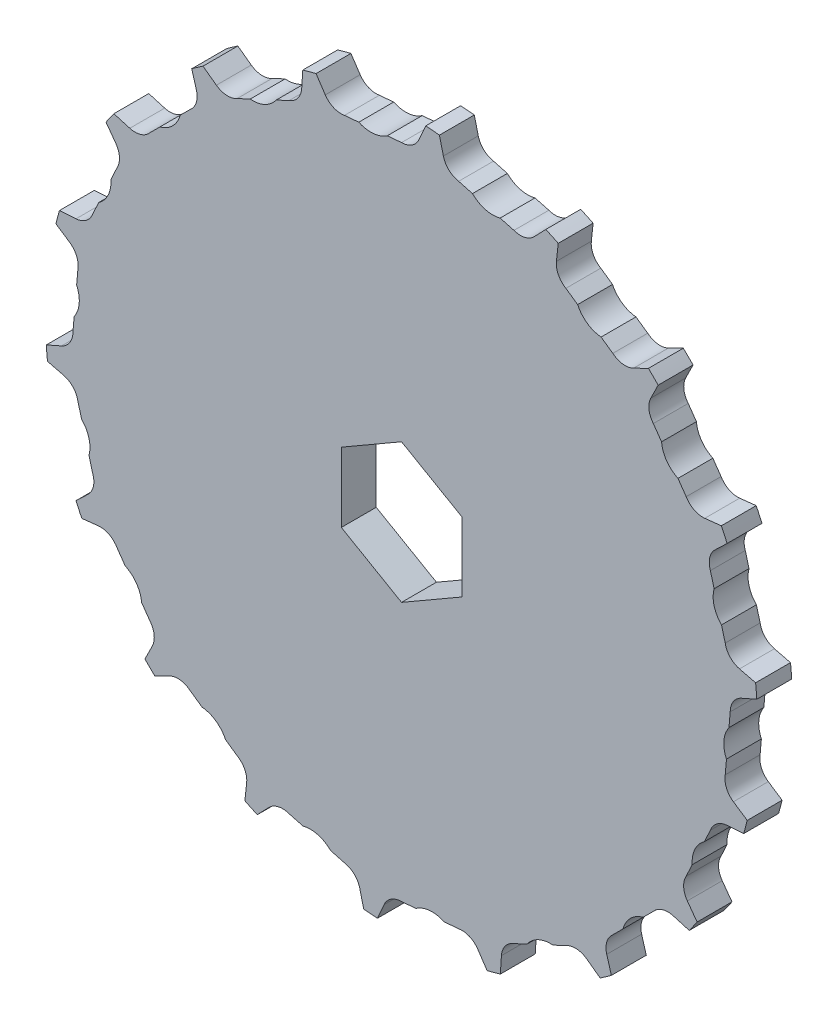
from build123d import *

# Parameters (mm, degrees)
BOSS_EXTRUDE1_DEPTH                 = 7.3
SKETCH2_R                           = 12.5
BOSS_EXTRUDE2_DEPTH                 = 40
CUT_EXTRUDE2_DEPTH                  = 10
SKETCH9_R                           = 100
SKETCH9_R_2                         = 74.5
CUT_EXTRUDE5_DEPTH                  = 10
FILLET1_R                           = 30
SKETCH3_R                           = 5
CUT_EXTRUDE1_DEPTH                  = 116.267299695
F_1_0MM_DOWEL_HOLE1_D               = 2.8
F_1_0MM_DOWEL_HOLE1_DEPTH           = 33.158795133
F_1_0MM_DOWEL_HOLE1_TIP             = 0.841204867
F_1_0MM_DOWEL_HOLE1_ON_FACE_2_D     = 2.8
F_1_0MM_DOWEL_HOLE1_ON_FACE_2_DEPTH = 33.158795133
F_1_0MM_DOWEL_HOLE1_ON_FACE_2_TIP   = 0.841204867
CIRPATTERN1_COUNT                   = 18
CUT_EXTRUDE3_DEPTH                  = 116.267299736
CUT_EXTRUDE3_DEPTH_BACK             = 116.267299736
SKETCH6_W                           = 154.233328221
SKETCH6_H                           = 44.757292759
CUT_EXTRUDE4_DEPTH                  = 106.368640397
CUT_EXTRUDE4_DEPTH_BACK             = 106.368640397


with BuildPart() as part:
    # Sketch1 → Boss-Extrude1 (new body)
    with BuildSketch(Plane.XY):
        with BuildLine():
            ThreePointArc((3.659616426, 71.150315011), (0, 68.765), (-3.659616426, 71.150315011))
            Line((-3.659616426, 71.150315011), (-5.674070045, 75.715990423))
            ThreePointArc((-5.674070045, 75.715990423), (-6.676129894, 76.308513874), (-7.560075586, 75.550986319))
            Line((-7.560075586, 75.550986319), (-8.751103913, 70.704867575))
            ThreePointArc((-8.751103913, 70.704867575), (-11.940916937, 67.720305136), (-15.959141171, 69.433896128))
            Line((-15.959141171, 69.433896128), (-18.735811929, 73.580402472))
            ThreePointArc((-18.735811929, 73.580402472), (-19.825538855, 73.989918294), (-20.564512145, 73.090403726))
            Line((-20.564512145, 73.090403726), (-20.895926387, 68.111088517))
            ThreePointArc((-20.895926387, 68.111088517), (-23.519015156, 64.617963068), (-27.773755488, 65.607763448))
            Line((-27.773755488, 65.607763448), (-31.228275648, 69.209111226))
            ThreePointArc((-31.228275648, 69.209111226), (-32.372558849, 69.423176487), (-32.94410641, 68.409006202))
            Line((-32.94410641, 68.409006202), (-32.405836712, 63.4477885))
            ThreePointArc((-32.405836712, 63.4477885), (-34.3825, 59.552236891), (-38.744478298, 59.788172074))
            Line((-38.744478298, 59.788172074), (-42.771884014, 62.734936156))
            ThreePointArc((-42.771884014, 62.734936156), (-43.935955024, 62.747046593), (-44.322710671, 61.64903564))
            Line((-44.322710671, 61.64903564), (-42.931112087, 56.856659535))
            ThreePointArc((-42.931112087, 56.856659535), (-44.20128998, 52.677046131), (-48.537969741, 52.151947345))
            Line((-48.537969741, 52.151947345), (-53.015890327, 54.354591797))
            ThreePointArc((-53.015890327, 54.354591797), (-54.164379439, 54.164379439), (-54.354591797, 53.015890327))
            Line((-54.354591797, 53.015890327), (-52.151947345, 48.537969741))
            ThreePointArc((-52.151947345, 48.537969741), (-52.677046131, 44.20128998), (-56.856659535, 42.931112087))
            Line((-56.856659535, 42.931112087), (-61.64903564, 44.322710671))
            ThreePointArc((-61.64903564, 44.322710671), (-62.747046593, 43.935955024), (-62.734936156, 42.771884014))
            Line((-62.734936156, 42.771884014), (-59.788172074, 38.744478298))
            ThreePointArc((-59.788172074, 38.744478298), (-59.552236891, 34.3825), (-63.4477885, 32.405836712))
            Line((-63.4477885, 32.405836712), (-68.409006202, 32.94410641))
            ThreePointArc((-68.409006202, 32.94410641), (-69.423176487, 32.372558849), (-69.209111226, 31.228275648))
            Line((-69.209111226, 31.228275648), (-65.607763448, 27.773755488))
            ThreePointArc((-65.607763448, 27.773755488), (-64.617963068, 23.519015156), (-68.111088517, 20.895926387))
            Line((-68.111088517, 20.895926387), (-73.090403726, 20.564512145))
            ThreePointArc((-73.090403726, 20.564512145), (-73.989918294, 19.825538855), (-73.580402472, 18.735811929))
            Line((-73.580402472, 18.735811929), (-69.433896128, 15.959141171))
            ThreePointArc((-69.433896128, 15.959141171), (-67.720305136, 11.940916937), (-70.704867575, 8.751103913))
            Line((-70.704867575, 8.751103913), (-75.550986319, 7.560075586))
            ThreePointArc((-75.550986319, 7.560075586), (-76.308513874, 6.676129894), (-75.715990423, 5.674070045))
            Line((-75.715990423, 5.674070045), (-71.150315011, 3.659616426))
            ThreePointArc((-71.150315011, 3.659616426), (-68.765, 0), (-71.150315011, -3.659616426))
            Line((-71.150315011, -3.659616426), (-75.715990423, -5.674070045))
            ThreePointArc((-75.715990423, -5.674070045), (-76.308513874, -6.676129894), (-75.550986319, -7.560075586))
            Line((-75.550986319, -7.560075586), (-70.704867575, -8.751103913))
            ThreePointArc((-70.704867575, -8.751103913), (-67.720305136, -11.940916937), (-69.433896128, -15.959141171))
            Line((-69.433896128, -15.959141171), (-73.580402472, -18.735811929))
            ThreePointArc((-73.580402472, -18.735811929), (-73.989918294, -19.825538855), (-73.090403726, -20.564512145))
            Line((-73.090403726, -20.564512145), (-68.111088517, -20.895926387))
            ThreePointArc((-68.111088517, -20.895926387), (-64.617963068, -23.519015156), (-65.607763448, -27.773755488))
            Line((-65.607763448, -27.773755488), (-69.209111226, -31.228275648))
            ThreePointArc((-69.209111226, -31.228275648), (-69.423176487, -32.372558849), (-68.409006202, -32.94410641))
            Line((-68.409006202, -32.94410641), (-63.4477885, -32.405836712))
            ThreePointArc((-63.4477885, -32.405836712), (-59.552236891, -34.3825), (-59.788172074, -38.744478298))
            Line((-59.788172074, -38.744478298), (-62.734936156, -42.771884014))
            ThreePointArc((-62.734936156, -42.771884014), (-62.747046593, -43.935955024), (-61.64903564, -44.322710671))
            Line((-61.64903564, -44.322710671), (-56.856659535, -42.931112087))
            ThreePointArc((-56.856659535, -42.931112087), (-52.677046131, -44.20128998), (-52.151947345, -48.537969741))
            Line((-52.151947345, -48.537969741), (-54.354591797, -53.015890327))
            ThreePointArc((-54.354591797, -53.015890327), (-54.164379439, -54.164379439), (-53.015890327, -54.354591797))
            Line((-53.015890327, -54.354591797), (-48.537969741, -52.151947345))
            ThreePointArc((-48.537969741, -52.151947345), (-44.20128998, -52.677046131), (-42.931112087, -56.856659535))
            Line((-42.931112087, -56.856659535), (-44.322710671, -61.64903564))
            ThreePointArc((-44.322710671, -61.64903564), (-43.935955024, -62.747046593), (-42.771884014, -62.734936156))
            Line((-42.771884014, -62.734936156), (-38.744478298, -59.788172074))
            ThreePointArc((-38.744478298, -59.788172074), (-34.3825, -59.552236891), (-32.405836712, -63.4477885))
            Line((-32.405836712, -63.4477885), (-32.94410641, -68.409006202))
            ThreePointArc((-32.94410641, -68.409006202), (-32.372558849, -69.423176487), (-31.228275648, -69.209111226))
            Line((-31.228275648, -69.209111226), (-27.773755488, -65.607763448))
            ThreePointArc((-27.773755488, -65.607763448), (-23.519015156, -64.617963068), (-20.895926387, -68.111088517))
            Line((-20.895926387, -68.111088517), (-20.564512145, -73.090403726))
            ThreePointArc((-20.564512145, -73.090403726), (-19.825538855, -73.989918294), (-18.735811929, -73.580402472))
            Line((-18.735811929, -73.580402472), (-15.959141171, -69.433896128))
            ThreePointArc((-15.959141171, -69.433896128), (-11.940916937, -67.720305136), (-8.751103913, -70.704867575))
            Line((-8.751103913, -70.704867575), (-7.560075586, -75.550986319))
            ThreePointArc((-7.560075586, -75.550986319), (-6.676129894, -76.308513874), (-5.674070045, -75.715990423))
            Line((-5.674070045, -75.715990423), (-3.659616426, -71.150315011))
            ThreePointArc((-3.659616426, -71.150315011), (0, -68.765), (3.659616426, -71.150315011))
            Line((3.659616426, -71.150315011), (5.674070045, -75.715990423))
            ThreePointArc((5.674070045, -75.715990423), (6.676129894, -76.308513874), (7.560075586, -75.550986319))
            Line((7.560075586, -75.550986319), (8.751103913, -70.704867575))
            ThreePointArc((8.751103913, -70.704867575), (11.940916937, -67.720305136), (15.959141171, -69.433896128))
            Line((15.959141171, -69.433896128), (18.735811929, -73.580402472))
            ThreePointArc((18.735811929, -73.580402472), (19.825538855, -73.989918294), (20.564512145, -73.090403726))
            Line((20.564512145, -73.090403726), (20.895926387, -68.111088517))
            ThreePointArc((20.895926387, -68.111088517), (23.519015156, -64.617963068), (27.773755488, -65.607763448))
            Line((27.773755488, -65.607763448), (31.228275648, -69.209111226))
            ThreePointArc((31.228275648, -69.209111226), (32.372558849, -69.423176487), (32.94410641, -68.409006202))
            Line((32.94410641, -68.409006202), (32.405836712, -63.4477885))
            ThreePointArc((32.405836712, -63.4477885), (34.3825, -59.552236891), (38.744478298, -59.788172074))
            Line((38.744478298, -59.788172074), (42.771884014, -62.734936156))
            ThreePointArc((42.771884014, -62.734936156), (43.935955024, -62.747046593), (44.322710671, -61.64903564))
            Line((44.322710671, -61.64903564), (42.931112087, -56.856659535))
            ThreePointArc((42.931112087, -56.856659535), (44.20128998, -52.677046131), (48.537969741, -52.151947345))
            Line((48.537969741, -52.151947345), (53.015890327, -54.354591797))
            ThreePointArc((53.015890327, -54.354591797), (54.164379439, -54.164379439), (54.354591797, -53.015890327))
            Line((54.354591797, -53.015890327), (52.151947345, -48.537969741))
            ThreePointArc((52.151947345, -48.537969741), (52.677046131, -44.20128998), (56.856659535, -42.931112087))
            Line((56.856659535, -42.931112087), (61.64903564, -44.322710671))
            ThreePointArc((61.64903564, -44.322710671), (62.747046593, -43.935955024), (62.734936156, -42.771884014))
            Line((62.734936156, -42.771884014), (59.788172074, -38.744478298))
            ThreePointArc((59.788172074, -38.744478298), (59.552236891, -34.3825), (63.4477885, -32.405836712))
            Line((63.4477885, -32.405836712), (68.409006202, -32.94410641))
            ThreePointArc((68.409006202, -32.94410641), (69.423176487, -32.372558849), (69.209111226, -31.228275648))
            Line((69.209111226, -31.228275648), (65.607763448, -27.773755488))
            ThreePointArc((65.607763448, -27.773755488), (64.617963068, -23.519015156), (68.111088517, -20.895926387))
            Line((68.111088517, -20.895926387), (73.090403726, -20.564512145))
            ThreePointArc((73.090403726, -20.564512145), (73.989918294, -19.825538855), (73.580402472, -18.735811929))
            Line((73.580402472, -18.735811929), (69.433896128, -15.959141171))
            ThreePointArc((69.433896128, -15.959141171), (67.720305136, -11.940916937), (70.704867575, -8.751103913))
            Line((70.704867575, -8.751103913), (75.550986319, -7.560075586))
            ThreePointArc((75.550986319, -7.560075586), (76.308513874, -6.676129894), (75.715990423, -5.674070045))
            Line((75.715990423, -5.674070045), (71.150315011, -3.659616426))
            ThreePointArc((71.150315011, -3.659616426), (68.765, 0), (71.150315011, 3.659616426))
            Line((71.150315011, 3.659616426), (75.715990423, 5.674070045))
            ThreePointArc((75.715990423, 5.674070045), (76.308513874, 6.676129894), (75.550986319, 7.560075586))
            Line((75.550986319, 7.560075586), (70.704867575, 8.751103913))
            ThreePointArc((70.704867575, 8.751103913), (67.720305136, 11.940916937), (69.433896128, 15.959141171))
            Line((69.433896128, 15.959141171), (73.580402472, 18.735811929))
            ThreePointArc((73.580402472, 18.735811929), (73.989918294, 19.825538855), (73.090403726, 20.564512145))
            Line((73.090403726, 20.564512145), (68.111088517, 20.895926387))
            ThreePointArc((68.111088517, 20.895926387), (64.617963068, 23.519015156), (65.607763448, 27.773755488))
            Line((65.607763448, 27.773755488), (69.209111226, 31.228275648))
            ThreePointArc((69.209111226, 31.228275648), (69.423176487, 32.372558849), (68.409006202, 32.94410641))
            Line((68.409006202, 32.94410641), (63.4477885, 32.405836712))
            ThreePointArc((63.4477885, 32.405836712), (59.552236891, 34.3825), (59.788172074, 38.744478298))
            Line((59.788172074, 38.744478298), (62.734936156, 42.771884014))
            ThreePointArc((62.734936156, 42.771884014), (62.747046593, 43.935955024), (61.64903564, 44.322710671))
            Line((61.64903564, 44.322710671), (56.856659535, 42.931112087))
            ThreePointArc((56.856659535, 42.931112087), (52.677046131, 44.20128998), (52.151947345, 48.537969741))
            Line((52.151947345, 48.537969741), (54.354591797, 53.015890327))
            ThreePointArc((54.354591797, 53.015890327), (54.164379439, 54.164379439), (53.015890327, 54.354591797))
            Line((53.015890327, 54.354591797), (48.537969741, 52.151947345))
            ThreePointArc((48.537969741, 52.151947345), (44.20128998, 52.677046131), (42.931112087, 56.856659535))
            Line((42.931112087, 56.856659535), (44.322710671, 61.64903564))
            ThreePointArc((44.322710671, 61.64903564), (43.935955024, 62.747046593), (42.771884014, 62.734936156))
            Line((42.771884014, 62.734936156), (38.744478298, 59.788172074))
            ThreePointArc((38.744478298, 59.788172074), (34.3825, 59.552236891), (32.405836712, 63.4477885))
            Line((32.405836712, 63.4477885), (32.94410641, 68.409006202))
            ThreePointArc((32.94410641, 68.409006202), (32.372558849, 69.423176487), (31.228275648, 69.209111226))
            Line((31.228275648, 69.209111226), (27.773755488, 65.607763448))
            ThreePointArc((27.773755488, 65.607763448), (23.519015156, 64.617963068), (20.895926387, 68.111088517))
            Line((20.895926387, 68.111088517), (20.564512145, 73.090403726))
            ThreePointArc((20.564512145, 73.090403726), (19.825538855, 73.989918294), (18.735811929, 73.580402472))
            Line((18.735811929, 73.580402472), (15.959141171, 69.433896128))
            ThreePointArc((15.959141171, 69.433896128), (11.940916937, 67.720305136), (8.751103913, 70.704867575))
            Line((8.751103913, 70.704867575), (7.560075586, 75.550986319))
            ThreePointArc((7.560075586, 75.550986319), (6.676129894, 76.308513874), (5.674070045, 75.715990423))
            Line((5.674070045, 75.715990423), (3.659616426, 71.150315011))
        make_face()
    extrude(amount=BOSS_EXTRUDE1_DEPTH)

    # Sketch2 → Boss-Extrude2 (add)
    with BuildSketch(Plane.XY.offset(7.3)):
        Circle(SKETCH2_R)
    extrude(amount=BOSS_EXTRUDE2_DEPTH)

    # Sketch5 → Cut-Extrude2 (cut)
    with BuildSketch(Plane(origin=(0, 0, 0), x_dir=(-1, 0, 0), z_dir=(0, 0, -1))):
        with BuildLine():
            Line((0, 68.765), (2.988584094, 68.503532772))
            ThreePointArc((2.988584094, 68.503532772), (5.900736948, 67.445731938), (8.952332843, 67.981772364))
            Line((8.952332843, 67.981772364), (11.940916937, 67.720305136))
            Line((11.940916937, 67.720305136), (12.646588363, 75.786166442))
            Line((12.646588363, 75.786166442), (0.705671426, 76.830861306))
            Line((0.705671426, 76.830861306), (0, 68.765))
        make_face()
    cut_extrude2 = extrude(amount=-CUT_EXTRUDE2_DEPTH, mode=Mode.SUBTRACT)

    # Sketch9 → Cut-Extrude5 (cut)
    with BuildSketch(Plane(origin=(0, 0, 0), x_dir=(-1, 0, 0), z_dir=(0, 0, -1))):
        Circle(SKETCH9_R)
        Circle(SKETCH9_R_2, mode=Mode.SUBTRACT)
    extrude(amount=-CUT_EXTRUDE5_DEPTH, mode=Mode.SUBTRACT)

    # Fillet1
    fillet1_edges = [part.edges().sort_by_distance(p)[0] for p in [
        (-12.5, 0, 7.3),
    ]]
    fillet(fillet1_edges, radius=FILLET1_R)

    # Sketch3 → Cut-Extrude1 (cut, through all)
    with BuildSketch(Plane.XY.offset(47.3)):
        Circle(SKETCH3_R)
    extrude(amount=-CUT_EXTRUDE1_DEPTH, mode=Mode.SUBTRACT)

    # Ø1.0mm Dowel Hole1
    with Locations(Plane(origin=(-6.81763654, -10.477109907, 42.020116055), x_dir=(-0.838168792578, 0.545410923202, 0), z_dir=(-0.545410923202, -0.838168792578, 0))):
        with Locations((0, 0)):
            Hole(F_1_0MM_DOWEL_HOLE1_D / 2, depth=F_1_0MM_DOWEL_HOLE1_DEPTH)
            with Locations((0, 0, -(F_1_0MM_DOWEL_HOLE1_DEPTH + F_1_0MM_DOWEL_HOLE1_TIP / 2))):  # 118° drill point
                Cone(0, F_1_0MM_DOWEL_HOLE1_D / 2, F_1_0MM_DOWEL_HOLE1_TIP, mode=Mode.SUBTRACT)

    # Ø1.0mm Dowel Hole1 on face 2
    with Locations(Plane(origin=(-11.068439798, 5.808583342, 41.658255729), x_dir=(-0.464687003812, -0.885475007264, 0), z_dir=(-0.885475007264, 0.464687003812, 0))):
        with Locations((0, 0)):
            Hole(F_1_0MM_DOWEL_HOLE1_ON_FACE_2_D / 2, depth=F_1_0MM_DOWEL_HOLE1_ON_FACE_2_DEPTH)
            with Locations((0, 0, -(F_1_0MM_DOWEL_HOLE1_ON_FACE_2_DEPTH + F_1_0MM_DOWEL_HOLE1_ON_FACE_2_TIP / 2))):  # 118° drill point
                Cone(0, F_1_0MM_DOWEL_HOLE1_ON_FACE_2_D / 2, F_1_0MM_DOWEL_HOLE1_ON_FACE_2_TIP, mode=Mode.SUBTRACT)

    # CirPattern1: Cut-Extrude2 ×18 about axis
    cirpattern1_axis = Axis((0, 0, 0), (0, 0, 1))
    for i in range(1, CIRPATTERN1_COUNT):
        add(cut_extrude2.rotate(cirpattern1_axis, i * 360 / CIRPATTERN1_COUNT), mode=Mode.SUBTRACT)

    # Sketch6 → Cut-Extrude3 (cut, two sides: drawn at the far end of the back side and taken through both)
    with BuildSketch(Plane(origin=(0, 0, 0), x_dir=(1, 0, 0), z_dir=(0, 1, 0)).offset(-CUT_EXTRUDE3_DEPTH_BACK)):
        with Locations((2.788808029, -29.67864638)):
            Rectangle(SKETCH6_W, SKETCH6_H)
    extrude(amount=CUT_EXTRUDE3_DEPTH + CUT_EXTRUDE3_DEPTH_BACK, mode=Mode.SUBTRACT)

    # Sketch7 → Cut-Extrude4 (cut, two sides: drawn at the far end of the back side and taken through both)
    with BuildSketch(Plane(origin=(0, 0, 0), x_dir=(-1, 0, 0), z_dir=(0, 0, -1)).offset(-CUT_EXTRUDE4_DEPTH_BACK)):
        Polygon((12.6, -7.274613392), (12.6, 7.274613392), (0, 14.549226784), (-12.6, 7.274613392), (-12.6, -7.274613392), (0, -14.549226784), align=None)
    extrude(amount=CUT_EXTRUDE4_DEPTH + CUT_EXTRUDE4_DEPTH_BACK, mode=Mode.SUBTRACT)


solid = part.part
